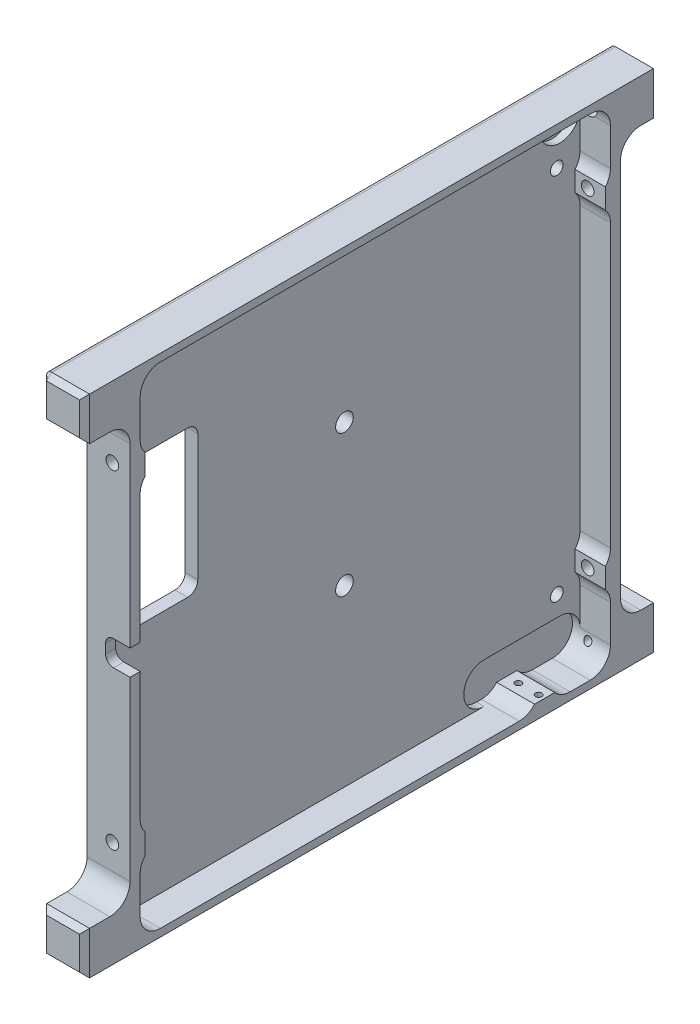
from build123d import *
from build123d.topology import SkipClean

# Parameters (mm, degrees)
SKETCH1_W                    = 81
SKETCH1_H                    = 83
BODY_DEPTH                   = 8.5
RAILFILLET_R                 = 1
FOOTCHAMFER_SIZE             = 1
SKETCH5_W                    = 81
SKETCH5_H                    = 83
BOSS_EXTRUDE3_DEPTH          = 8.5
SKETCH6_W                    = 93
SKETCH6_H                    = 97
CUT_EXTRUDE3_DEPTH           = 6
F_8_36_TAPPED_HOLE1_D        = 3.4544
F_8_36_TAPPED_HOLE1_DEPTH    = 13.55
F_8_36_TAPPED_HOLE1_TIP      = 1.037806461
SKETCH57_W                   = 1
SKETCH57_H                   = 4
BOSS_EXTRUDE24_DEPTH         = 6
FILLET5_R                    = 4
M3X0_5_TAPPED_HOLE1_D        = 2.5
FILLET7_R                    = 4
M3X0_5_TAPPED_HOLE2_D        = 2.5
M3X0_5_TAPPED_HOLE2_DEPTH    = 7.5
M3X0_5_TAPPED_HOLE2_TIP      = 0.751075774
FILLET8_R                    = 4
SKETCH70_R                   = 4
CUT_EXTRUDE14_DEPTH          = 1.5
SKETCH75_W                   = 7.5
SKETCH75_H                   = 4
BOSS_EXTRUDE25_DEPTH         = 1.4
M1_6X0_35_TAPPED_HOLE1_D     = 1.25
M1_6X0_35_TAPPED_HOLE1_DEPTH = 4.25
M1_6X0_35_TAPPED_HOLE1_TIP   = 0.375537887
FILLET9_R                    = 4
F_1_5MM_DOWEL_HOLE1_REACH    = 153.507
F_1_5MM_DOWEL_HOLE1_BORE_R   = 0.75
CUT_EXTRUDE15_DEPTH          = 152.387747196
SKETCH84_R                   = 1.75
CUT_EXTRUDE17_DEPTH          = 152.507425566
CUT_EXTRUDE18_DEPTH          = 2


# Some blends are built 0.0001 mm under size
with BuildPart() as part:
    # Sketch1 → Body (new body)
    with BuildSketch(Plane(origin=(0, 0, 0), x_dir=(0, 0, -1), z_dir=(1, 0, 0))):
        Polygon((-113.5, 0), (0, 0), (0, 8.5), (-7.5, 8.5), (-7.5, 91.5), (0, 91.5), (0, 100), (-113.5, 100), (-113.5, 91.5), (-104.5, 91.5), (-104.5, 8.5), (-113.5, 8.5), align=None)
        with Locations((-56, 50)):
            Rectangle(SKETCH1_W, SKETCH1_H, mode=Mode.SUBTRACT)
    extrude(amount=BODY_DEPTH)

    # RailFillet
    railfillet_edges = [part.edges().sort_by_distance(p)[0] for p in [
        (0, 0, 56.75),
        (0, 100, 56.75),
    ]]
    fillet(railfillet_edges, radius=RAILFILLET_R)

    # FootChamfer
    footchamfer_edges = [part.edges().sort_by_distance(p)[0] for p in [
        (8.5, 95.75, 0),
        (0, 95.25, 113.5),
        (8.5, 95.75, 113.5),
        (0, 95.25, 0),
        (4.25, 8.5, 0),
        (4.75, 0, 0),
        (4.75, 0, 113.5),
        (4.25, 8.5, 113.5),
        (4.25, 91.5, 113.5),
        (4.75, 100, 113.5),
        (4.75, 100, 0),
        (4.25, 91.5, 0),
        (8.5, 4.25, 113.5),
        (8.5, 4.25, 0),
        (0, 4.75, 0),
        (0, 4.75, 113.5),
        (0.292893219, 0.292893219, 113.5),
        (0.292893219, 0.292893219, 0),
        (0.292893219, 99.707106781, 113.5),
        (0.292893219, 99.707106781, 0),
    ]]
    chamfer(footchamfer_edges, length=FOOTCHAMFER_SIZE - 0.0001)  # a hair under: the kernel refuses the full size

    # Sketch5 → Boss-Extrude3 (add)
    with BuildSketch(Plane(origin=(8.5, 0, 0), x_dir=(0, 0, -1), z_dir=(1, 0, 0))):
        with Locations((-56, 50)):
            Rectangle(SKETCH5_W, SKETCH5_H)
    extrude(amount=-BOSS_EXTRUDE3_DEPTH)

    # Sketch6 → Cut-Extrude3 (cut)
    with BuildSketch(Plane(origin=(8.5, 0, 0), x_dir=(0, 0, -1), z_dir=(1, 0, 0))):
        with Locations((-56, 50)):
            Rectangle(SKETCH6_W, SKETCH6_H)
    extrude(amount=-CUT_EXTRUDE3_DEPTH, mode=Mode.SUBTRACT)

    # #8-36 Tapped Hole1
    with Locations(Plane(origin=(0, 0, 0), x_dir=(-1, 0, 0), z_dir=(0, 0, -1))):
        with Locations((-4.25, 95.75)):
            Hole(F_8_36_TAPPED_HOLE1_D / 2, depth=F_8_36_TAPPED_HOLE1_DEPTH)
            with Locations((0, 0, -(F_8_36_TAPPED_HOLE1_DEPTH + F_8_36_TAPPED_HOLE1_TIP / 2))):  # 118° drill point
                Cone(0, F_8_36_TAPPED_HOLE1_D / 2, F_8_36_TAPPED_HOLE1_TIP, mode=Mode.SUBTRACT)

    # Sketch57 → Boss-Extrude24 (add)
    with BuildSketch(Plane(origin=(2.5, 0, 0), x_dir=(0, 0, -1), z_dir=(1, 0, 0))):
        with Locations((-102, 82.5)):
            Rectangle(SKETCH57_W, SKETCH57_H)
        with Locations((-102, 17.5)):
            Rectangle(SKETCH57_W, SKETCH57_H)
        with Locations((-10, 17.5)):
            Rectangle(SKETCH57_W, SKETCH57_H)
        with Locations((-10, 82.5)):
            Rectangle(SKETCH57_W, SKETCH57_H)
    extrude(amount=BOSS_EXTRUDE24_DEPTH)

    # Fillet5
    # the kernel refuses this fillet: 4 mm, written as the material it adds along each edge
    with BuildSketch(Plane(origin=(2.5, 84.5, 102.5), x_dir=(0, 1, 0), z_dir=(1, 0, 0)), Plane(origin=(2.5, 19.5, 102.5), x_dir=(0, 1, 0), z_dir=(1, 0, 0)), Plane(origin=(2.5, 15.5, 9.5), x_dir=(0, -1, 0), z_dir=(1, 0, 0)), Plane(origin=(2.5, 80.5, 9.5), x_dir=(0, -1, 0), z_dir=(1, 0, 0))) as fillet5_piece_1:
        with BuildLine():
            CenterArc((2.645751311, -4), FILLET5_R, 90, 41.409622109)
            Line((0, -1), (-0.052915026, -0.94))
            ThreePointArc((-0.052915026, -0.94), (-0.08, -0.5), (-0.08, 0))
            Line((-0.08, 0), (0, 0.08))
            Line((0, 0.08), (2.645751311, 0.08))
            Line((2.645751311, 0.08), (2.645751311, 0))
        make_face()
    extrude(amount=6)
    with BuildSketch(Plane(origin=(2.5, 80.5, 102.5), x_dir=(0, -1, 0), z_dir=(1, 0, 0)), Plane(origin=(2.5, 15.5, 102.5), x_dir=(0, -1, 0), z_dir=(1, 0, 0)), Plane(origin=(2.5, 19.5, 9.5), x_dir=(0, 1, 0), z_dir=(1, 0, 0)), Plane(origin=(2.5, 84.5, 9.5), x_dir=(0, 1, 0), z_dir=(1, 0, 0))) as fillet5_piece_2:
        with BuildLine():
            CenterArc((2.645751311, 4), FILLET5_R, 228.590377891, 41.409622109)
            Line((0, 1), (-0.052915026, 0.94))
            ThreePointArc((-0.052915026, 0.94), (-0.08, 0.5), (-0.08, 0))
            Line((-0.08, 0), (0, -0.08))
            Line((0, -0.08), (2.645751311, -0.08))
            Line((2.645751311, -0.08), (2.645751311, 0))
        make_face()
    extrude(amount=6)

    # M3x0.5 Tapped Hole1 (through all)
    with Locations(Plane(origin=(0, 0, 7.5), x_dir=(-1, 0, 0), z_dir=(0, 0, -1))):
        with Locations((-5, 82.5), (-5, 17.5)):
            Hole(M3X0_5_TAPPED_HOLE1_D / 2)

    # Fillet7
    # the kernel refuses this fillet: 4 mm, written as the material it adds along each edge
    with BuildSketch(Plane(origin=(8.5, 1.5, 102.5), x_dir=(0, 1, 0), z_dir=(-1, 0, 0)), Plane(origin=(8.5, 98.5, 102.5), x_dir=(0, 0, -1), z_dir=(-1, 0, 0)), Plane(origin=(8.5, 1.5, 9.5), x_dir=(0, 0, 1), z_dir=(-1, 0, 0))) as fillet7_piece_1:
        with BuildLine():
            CenterArc((FILLET7_R, FILLET7_R), FILLET7_R, 180, 90)
            Line((0, FILLET7_R), (0, 0))
            Line((0, 0), (FILLET7_R, 0))
        make_face()
    extrude(amount=6)
    with BuildSketch(Plane(origin=(8.5, 98.5, 9.5), x_dir=(0, -1, 0), z_dir=(-1, 0, 0))) as fillet7_piece_2_section:
        with BuildLine():
            CenterArc((FILLET7_R, FILLET7_R), FILLET7_R, 180, 90)
            Line((0, FILLET7_R), (0, 0))
            Line((0, 0), (FILLET7_R, 0))
        make_face()
    fillet7_piece_2 = extrude(amount=6, mode=Mode.PRIVATE)
    fillet7_piece_2 = fillet7_piece_2 - Plane(origin=(4.25, 95.75, 10.518489618), x_dir=(1, 0, 0), z_dir=(0, 0, 1)) * Cylinder(1.7272, 28, mode=Mode.PRIVATE)
    add(fillet7_piece_2)

    # M3x0.5 Tapped Hole2
    with Locations(Plane.ZY):
        with Locations((14.1, 13.5), (14.1, 86.5), (98.1, 86.5), (98.1, 13.5)):
            Hole(M3X0_5_TAPPED_HOLE2_D / 2, depth=M3X0_5_TAPPED_HOLE2_DEPTH)
            with Locations((0, 0, -(M3X0_5_TAPPED_HOLE2_DEPTH + M3X0_5_TAPPED_HOLE2_TIP / 2))):  # 118° drill point
                Cone(0, M3X0_5_TAPPED_HOLE2_D / 2, M3X0_5_TAPPED_HOLE2_TIP, mode=Mode.SUBTRACT)

    # Fillet8
    fillet8_edges = [part.edges().sort_by_distance(p)[0] for p in [
        (4.25, 8.5, 7.5),
        (4.25, 8.5, 104.5),
        (4.25, 91.5, 104.5),
        (4.25, 91.5, 7.5),
    ]]
    fillet(fillet8_edges, radius=FILLET8_R)

    # Sketch70 → Cut-Extrude14 (cut)
    with BuildSketch(Plane(origin=(2.5, 0, 0), x_dir=(0, 0, -1), z_dir=(1, 0, 0))):
        with BuildLine():
            ThreePointArc((-13.5, 1.5), (-9.5, 5.5), (-13.5, 9.5))
            Line((-13.5, 9.5), (-28.5, 9.5))
            ThreePointArc((-28.5, 9.5), (-32.5, 5.5), (-28.5, 1.5))
            Line((-28.5, 1.5), (-13.5, 1.5))
        make_face()
        with Locations((-13.5, 94.5)):
            Circle(SKETCH70_R)
    extrude(amount=-CUT_EXTRUDE14_DEPTH, mode=Mode.SUBTRACT)

    # Sketch75 → Boss-Extrude25 (add)
    with BuildSketch(Plane(origin=(0, 1.5, 0), x_dir=(1, 0, 0), z_dir=(0, 1, 0))):
        with Locations((4.75, -22.5)):
            Rectangle(SKETCH75_W, SKETCH75_H)
    extrude(amount=BOSS_EXTRUDE25_DEPTH)

    # M1.6x0.35 Tapped Hole1
    with Locations(Plane(origin=(0, 2.9, 0), x_dir=(1, 0, 0), z_dir=(0, 1, 0))):
        with Locations((3.3, -22.5), (7.3, -22.5)):
            Hole(M1_6X0_35_TAPPED_HOLE1_D / 2, depth=M1_6X0_35_TAPPED_HOLE1_DEPTH)
            with Locations((0, 0, -(M1_6X0_35_TAPPED_HOLE1_DEPTH + M1_6X0_35_TAPPED_HOLE1_TIP / 2))):  # 118° drill point
                Cone(0, M1_6X0_35_TAPPED_HOLE1_D / 2, M1_6X0_35_TAPPED_HOLE1_TIP, mode=Mode.SUBTRACT)

    # Fillet9
    # the kernel refuses this fillet: 4 mm, written as the material it adds along each edge
    with BuildSketch(Plane(origin=(8.5, 1.5, 24.5), x_dir=(0, 1, 0), z_dir=(-1, 0, 0))) as fillet9_piece_1:
        with BuildLine():
            CenterArc((4, -3.039736831), FILLET9_R, 130.541601874, 49.458398126)
            Line((0, -3.039736831), (-0.08, -3.039736831))
            Line((-0.08, -3.039736831), (-0.08, 0))
            Line((-0.08, 0), (0, 0.08))
            ThreePointArc((0, 0.08), (0.7, 0.08), (1.348, 0.060794737))
            Line((1.348, 0.060794737), (1.4, 0))
        make_face()
    extrude(amount=6)
    with BuildSketch(Plane(origin=(2.5, 1.5, 20.5), x_dir=(0, 0, -1), z_dir=(1, 0, 0))) as fillet9_piece_2:
        with BuildLine():
            CenterArc((3.039736831, 4), FILLET9_R, 220.541601874, 49.458398126)
            Line((0, 1.4), (-0.060794737, 1.348))
            ThreePointArc((-0.060794737, 1.348), (-0.08, 0.7), (-0.08, 0))
            Line((-0.08, 0), (0, -0.08))
            Line((0, -0.08), (3.039736831, -0.08))
            Line((3.039736831, -0.08), (3.039736831, 0))
        make_face()
    extrude(amount=6)
    with BuildSketch(Plane(origin=(1, 1.5, 20.5), x_dir=(0, 1, 0), z_dir=(1, 0, 0)), Plane(origin=(2.5, 1.5, 24.5), x_dir=(0, 1, 0), z_dir=(-1, 0, 0))) as fillet9_piece_3:
        with BuildLine():
            CenterArc((4, -3.039736831), FILLET9_R, 130.541601874, 49.458398126)
            Line((0, -3.039736831), (-0.08, -3.039736831))
            Line((-0.08, -3.039736831), (-0.08, 0))
            Line((-0.08, 0), (0, 0.08))
            ThreePointArc((0, 0.08), (0.7, 0.08), (1.348, 0.060794737))
            Line((1.348, 0.060794737), (1.4, 0))
        make_face()
    extrude(amount=1.5)

    # Ø1.5mm Dowel Hole1 bore → Ø1.5mm Dowel Hole1 (cut, up to next)
    with BuildSketch(Plane(origin=(0, 0, 0), x_dir=(-1, 0, 0), z_dir=(0, 0, -1)), mode=Mode.PRIVATE) as f_1_5mm_dowel_hole1_sk1:
        with Locations((-4.25, 4.25)):
            Circle(F_1_5MM_DOWEL_HOLE1_BORE_R)
    f_1_5mm_dowel_hole1_tool1 = extrude(f_1_5mm_dowel_hole1_sk1.sketch, amount=-F_1_5MM_DOWEL_HOLE1_REACH, mode=Mode.PRIVATE) & part.part
    add(f_1_5mm_dowel_hole1_tool1.solids().sort_by_distance((4.25, 4.25, 0))[0], mode=Mode.SUBTRACT)

    # Sketch81 → Cut-Extrude15 (cut, through all)
    with SkipClean():  # the faces are left unmerged after this step: merging them gives an invalid solid
        with BuildSketch(Plane(origin=(2.5, 0, 0), x_dir=(0, 0, -1), z_dir=(1, 0, 0))):
            with BuildLine():
                ThreePointArc((-102.5, 51.5), (-101.914213562, 50.085786438), (-100.5, 49.5))
                ThreePointArc((-100.5, 49.5), (-99.085786438, 50.085786438), (-98.5, 51.5))
                Line((-98.5, 51.5), (-98.5, 76.5))
                ThreePointArc((-98.5, 76.5), (-99.085786438, 77.914213562), (-100.5, 78.5))
                ThreePointArc((-100.5, 78.5), (-101.914213562, 77.914213562), (-102.5, 76.5))
                Line((-102.5, 76.5), (-102.5, 51.5))
            make_face()
            with BuildLine():
                Line((-85.1, 51.5), (-85.1, 76.5))
                ThreePointArc((-85.1, 76.5), (-87.1, 78.5), (-89.1, 76.5))
                Line((-89.1, 76.5), (-89.1, 51.5))
                ThreePointArc((-89.1, 51.5), (-87.1, 49.5), (-85.1, 51.5))
            make_face()
            with BuildLine():
                ThreePointArc((-87.1, 49.5), (-88.514213562, 50.085786438), (-89.1, 51.5))
                Line((-89.1, 51.5), (-89.1, 76.5))
                ThreePointArc((-89.1, 76.5), (-88.514213562, 77.914213562), (-87.1, 78.5))
                Line((-87.1, 78.5), (-100.5, 78.5))
                ThreePointArc((-100.5, 78.5), (-99.085786438, 77.914213562), (-98.5, 76.5))
                Line((-98.5, 76.5), (-98.5, 51.5))
                ThreePointArc((-98.5, 51.5), (-99.085786438, 50.085786438), (-100.5, 49.5))
                Line((-100.5, 49.5), (-87.1, 49.5))
            make_face()
        extrude(amount=-CUT_EXTRUDE15_DEPTH, mode=Mode.SUBTRACT)

    # Sketch84 → Cut-Extrude17 (cut, through all)
    with SkipClean():  # the faces are left unmerged after this step: merging them gives an invalid solid
        with BuildSketch(Plane.ZY):
            with Locations((56.1, 36)):
                Circle(SKETCH84_R)
            with Locations((56.1, 64)):
                Circle(SKETCH84_R)
        extrude(amount=-CUT_EXTRUDE17_DEPTH, mode=Mode.SUBTRACT)

    # Sketch85 → Cut-Extrude18 (cut)
    with BuildSketch(Plane.XY.offset(104.5)):
        with BuildLine():
            Line((5.25, 47.5), (8.5, 47.5))
            Line((8.5, 47.5), (8.5, 52.5))
            Line((8.5, 52.5), (5.25, 52.5))
            ThreePointArc((5.25, 52.5), (4.125700218, 52.034299782), (3.66, 50.91))
            Line((3.66, 50.91), (3.66, 49.09))
            ThreePointArc((3.66, 49.09), (4.125700218, 47.965700218), (5.25, 47.5))
        make_face()
    extrude(amount=-CUT_EXTRUDE18_DEPTH, mode=Mode.SUBTRACT)


solid = part.part
